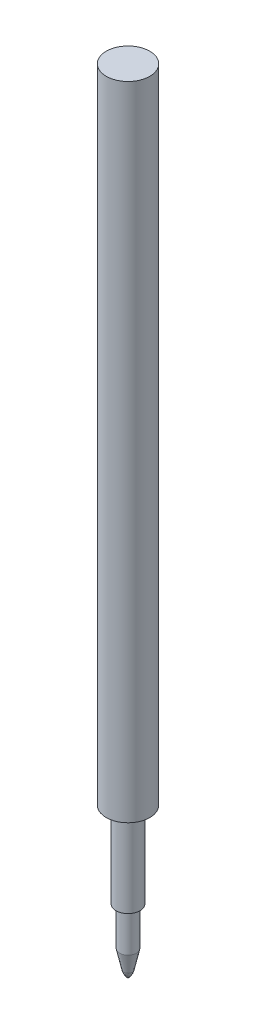
from build123d import *


with BuildPart() as part:
    # Sketch1 → Revolve1 (revolve)
    with BuildSketch(Plane.XY):
        with BuildLine():
            Line((0, 0), (0, 111))
            Line((0, 111), (3.05, 111))
            Line((3.05, 111), (3.05, 21))
            Line((3.05, 21), (1.675, 21))
            Line((1.675, 21), (1.675, 9))
            Line((1.675, 9), (1.175, 9))
            Line((1.175, 9), (1.175, 3.6))
            Line((1.175, 3.6), (0.6, 1))
            ThreePointArc((0.6, 1), (0.381400138, 0.451159917), (0, 0))
        make_face()
    revolve(axis=Axis((0, 0, 0), (0, 1, 0)))


solid = part.part
